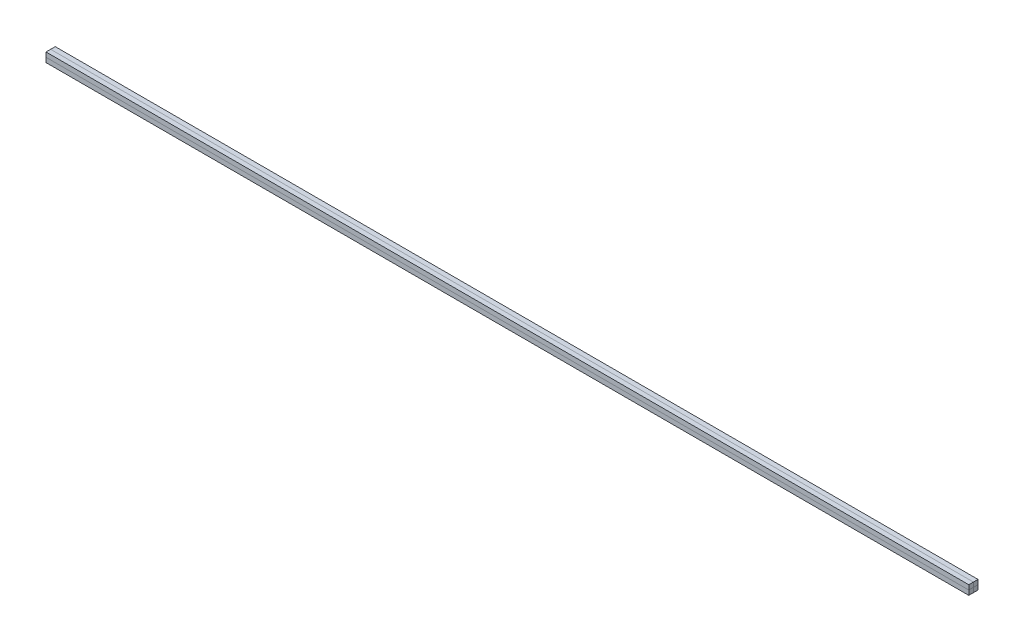
from build123d import *

# Parameters (mm, degrees)
SKETCH_1_W                 = 10
SKETCH_1_H                 = 10
EXTRUDE_1_DEPTH            = 1000
SPLIT_START                = -5
SPLIT_BODIES_1_OUTLINE_W   = 1000
SPLIT_BODIES_1_OUTLINE_H   = 5
SPLIT_BODIES_1_DEPTH       = 10
SPLIT_BODIES_1_2_OUTLINE_W = 1000
SPLIT_BODIES_1_2_OUTLINE_H = 5
SPLIT_BODIES_1_2_DEPTH     = 5
SPLIT_BODIES_1_3_OUTLINE_W = 1000
SPLIT_BODIES_1_3_OUTLINE_H = 5
SPLIT_BODIES_1_3_DEPTH     = 5
SPLIT_BODIES_1_4_OUTLINE_W = 1000
SPLIT_BODIES_1_4_OUTLINE_H = 5
SPLIT_BODIES_1_4_DEPTH     = 5
SPLIT_BODIES_1_5_OUTLINE_W = 1000
SPLIT_BODIES_1_5_OUTLINE_H = 5
SPLIT_BODIES_1_5_DEPTH     = 5


# Read off the part's stored shape, not the designer's step: Разделить1
with BuildPart() as part:
    # Эскиз1 → Бобышка-Вытянуть1 (new body)
    with BuildSketch(Plane(origin=(0, 0, 0), x_dir=(0, 0, -1), z_dir=(1, 0, 0))):
        Rectangle(SKETCH_1_W, SKETCH_1_H)
    extrude(amount=EXTRUDE_1_DEPTH)

    # Split Bodies 1 outline → Split Bodies 1 (cut)
    with BuildSketch(Plane(origin=(0, 0, 0), x_dir=(1, 0, 0), z_dir=(0, 1, 0)).offset(SPLIT_START)):
        with Locations((500, -2.5)):
            Rectangle(SPLIT_BODIES_1_OUTLINE_W, SPLIT_BODIES_1_OUTLINE_H)
    extrude(amount=SPLIT_BODIES_1_DEPTH, mode=Mode.SUBTRACT)

    # Split Bodies 1 2 outline → Split Bodies 1 2 (cut)
    with BuildSketch(Plane(origin=(0, 0, 0), x_dir=(1, 0, 0), z_dir=(0, 1, 0))):
        with Locations((500, 2.5)):
            Rectangle(SPLIT_BODIES_1_2_OUTLINE_W, SPLIT_BODIES_1_2_OUTLINE_H)
    extrude(amount=SPLIT_BODIES_1_2_DEPTH, mode=Mode.SUBTRACT)


with BuildPart() as body_2:
    # Split Bodies 1 3 outline → Split Bodies 1 3 (new body)
    with BuildSketch(Plane(origin=(0, 0, 0), x_dir=(1, 0, 0), z_dir=(0, 1, 0))):
        with Locations((500, -2.5)):
            Rectangle(SPLIT_BODIES_1_3_OUTLINE_W, SPLIT_BODIES_1_3_OUTLINE_H)
    extrude(amount=SPLIT_BODIES_1_3_DEPTH)


with BuildPart() as body_3:
    # Split Bodies 1 4 outline → Split Bodies 1 4 (new body)
    with BuildSketch(Plane.XY):
        with Locations((500, -2.5)):
            Rectangle(SPLIT_BODIES_1_4_OUTLINE_W, SPLIT_BODIES_1_4_OUTLINE_H)
    extrude(amount=SPLIT_BODIES_1_4_DEPTH)


with BuildPart() as body_4:
    # Split Bodies 1 5 outline → Split Bodies 1 5 (new body)
    with BuildSketch(Plane(origin=(0, 0, 0), x_dir=(1, 0, 0), z_dir=(0, 1, 0))):
        with Locations((500, 2.5)):
            Rectangle(SPLIT_BODIES_1_5_OUTLINE_W, SPLIT_BODIES_1_5_OUTLINE_H)
    extrude(amount=SPLIT_BODIES_1_5_DEPTH)


solid = Compound([part.part, body_2.part, body_3.part, body_4.part])
